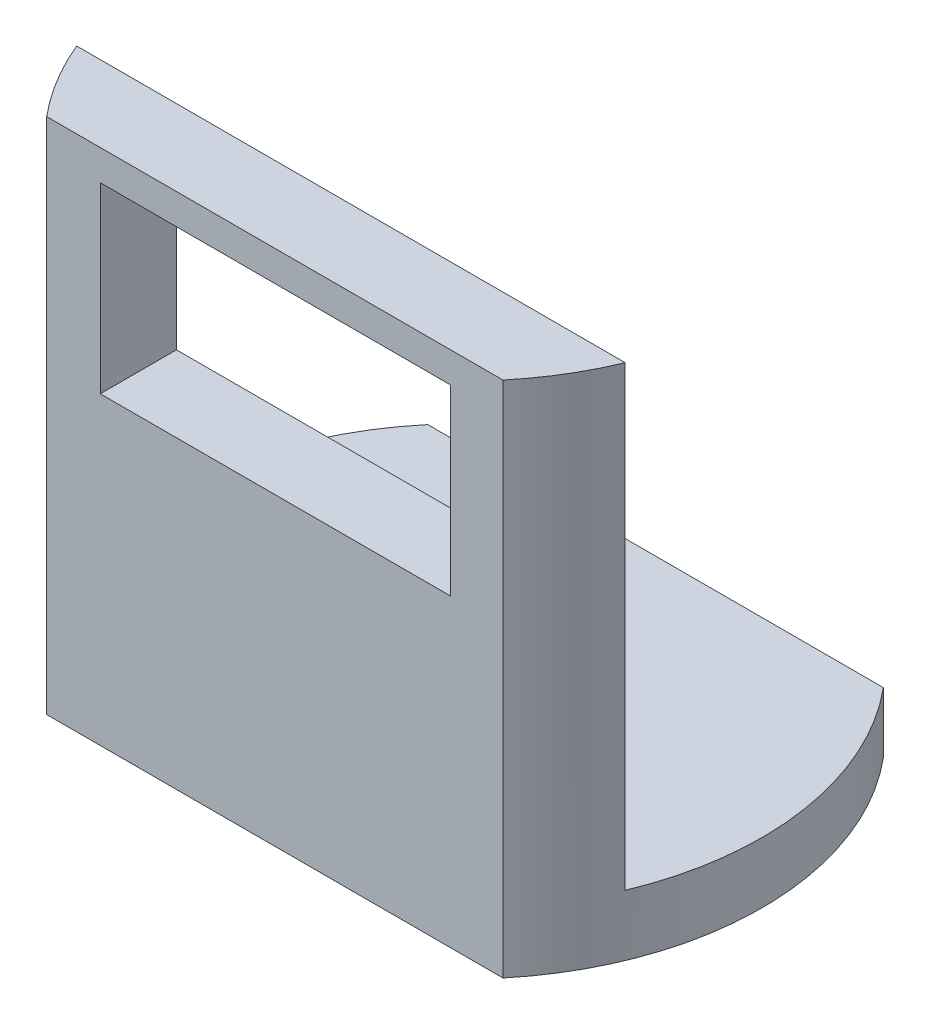
from build123d import *

# Parameters (mm, degrees)
ESQUISSE1_W             = 40
ESQUISSE1_H             = 30
BOSS_EXTRU_1_DEPTH      = 5
ESQUISSE4_W             = 40
ESQUISSE4_H             = 25
BOSS_EXTRU_2_DEPTH      = 4
ESQUISSE5_W             = 23
ESQUISSE5_H             = 12
ENL_V_MAT_EXTRU_2_DEPTH = 5
ESQUISSE6_R             = 10
ENL_V_MAT_EXTRU_3_DEPTH = 2
ENL_V_START             = -34
ENL_V_MAT_EXTRU_4_DEPTH = 34


# Read off the part's stored shape, not the designer's step: Enlèv. mat.-Extru.4
with BuildPart() as part:
    # Esquisse1 → Boss.-Extru.1 (new body)
    with BuildSketch(Plane.XY):
        Rectangle(ESQUISSE1_W, ESQUISSE1_H)
    extrude(amount=BOSS_EXTRU_1_DEPTH)

    # Esquisse4 → Boss.-Extru.2 (add)
    with BuildSketch(Plane.XZ.offset(15)):
        with Locations((0, -7.5)):
            Rectangle(ESQUISSE4_W, ESQUISSE4_H)
    extrude(amount=BOSS_EXTRU_2_DEPTH)

    # Esquisse5 → Enlèv. mat.-Extru.2 (cut)
    with BuildSketch(Plane(origin=(0, 0, 0), x_dir=(-1, 0, 0), z_dir=(0, 0, -1))):
        with Locations((0, 7)):
            Rectangle(ESQUISSE5_W, ESQUISSE5_H)
    extrude(amount=-ENL_V_MAT_EXTRU_2_DEPTH, mode=Mode.SUBTRACT)

    # Esquisse6 → Enlèv. mat.-Extru.3 (cut)
    with BuildSketch(Plane.XZ.offset(19)):
        with Locations(Location((-0.043131573, -7.485697827, 0), (0, 0, 270))):
            Circle(ESQUISSE6_R)
    extrude(amount=-ENL_V_MAT_EXTRU_3_DEPTH, mode=Mode.SUBTRACT)

    # Enlèv. mat.-Extru.4 outline → Enlèv. mat.-Extru.4 (cut)
    with BuildSketch(Plane.XZ.offset(19).offset(ENL_V_START)):
        with BuildLine():
            ThreePointArc((14.935431434, 5), (19.456859524, -7.504332113), (14.911541313, -20))
            Line((14.911541313, -20), (20, -20))
            Line((20, -20), (20, 5))
            Line((20, 5), (14.935431434, 5))
        make_face()
        with BuildLine():
            Line((-20, -20), (-14.997804459, -20))
            ThreePointArc((-14.997804459, -20), (-19.543122669, -7.504332113), (-15.02169458, 5))
            Line((-15.02169458, 5), (-20, 5))
            Line((-20, 5), (-20, -20))
        make_face()
    extrude(amount=ENL_V_MAT_EXTRU_4_DEPTH, mode=Mode.SUBTRACT)


solid = part.part
